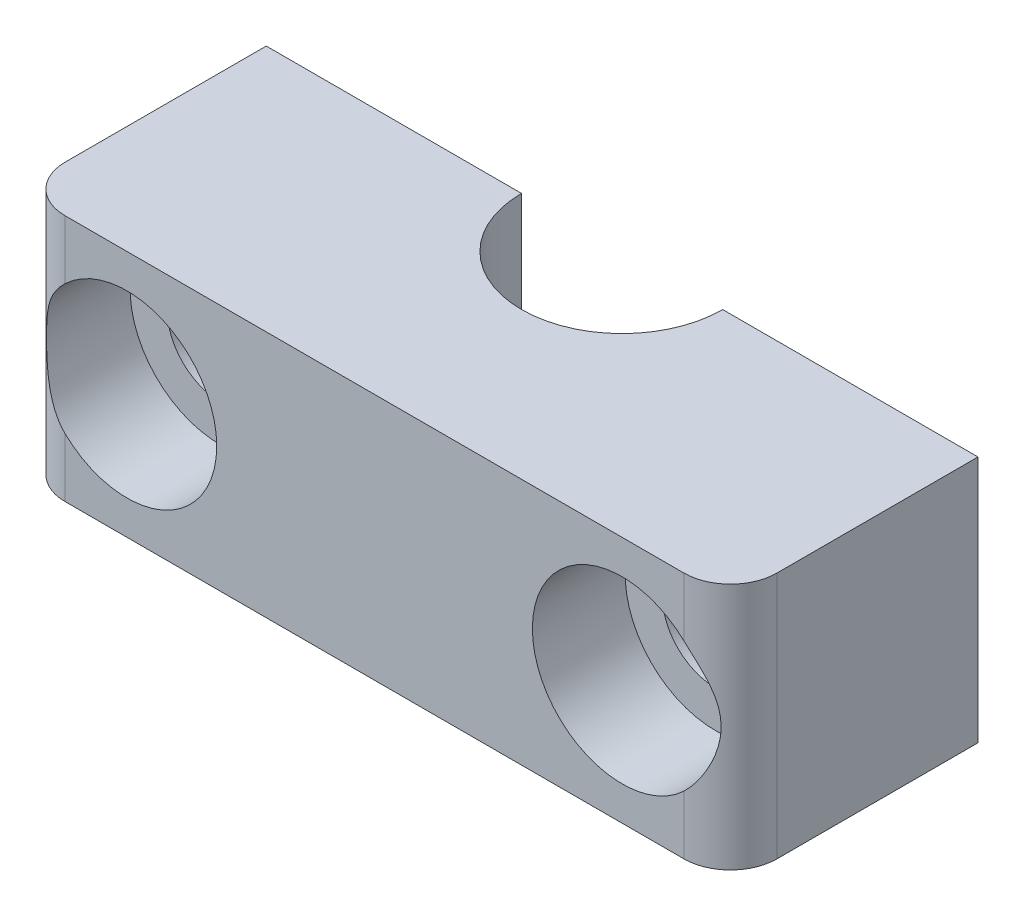
from build123d import *

# Parameters (mm, degrees)
SKETCH1_W                      = 23
SKETCH1_H                      = 8
BOSS_EXTRUDE1_DEPTH            = 8
SKETCH2_R                      = 5
CUT_EXTRUDE1_DEPTH             = 15.568802284
CBORE_FOR_M3_SHCS1_D           = 3.4
CBORE_FOR_M3_SHCS1_CBORE_D     = 5.8
CBORE_FOR_M3_SHCS1_CBORE_DEPTH = 3
SKETCH8_R                      = 3.25
CUT_EXTRUDE2_DEPTH             = 15.568802284
FILLET1_R                      = 1.5


with BuildPart() as part:
    # Sketch1 → Boss-Extrude1 (new body)
    with BuildSketch(Plane.XY):
        Rectangle(SKETCH1_W, SKETCH1_H)
    extrude(amount=BOSS_EXTRUDE1_DEPTH)

    # Sketch2 → Cut-Extrude1 (cut, through all)
    with BuildSketch(Plane(origin=(0, 0, 0), x_dir=(1, 0, 0), z_dir=(0, 1, 0))):
        Circle(SKETCH2_R)
    extrude(amount=-CUT_EXTRUDE1_DEPTH, mode=Mode.SUBTRACT)

    # CBORE for M3 SHCS1 (through all)
    with Locations(Plane.XY.offset(8)):
        with Locations((-8, 0), (8, 0)):
            CounterBoreHole(CBORE_FOR_M3_SHCS1_D / 2, CBORE_FOR_M3_SHCS1_CBORE_D / 2, CBORE_FOR_M3_SHCS1_CBORE_DEPTH)

    # Sketch8 → Cut-Extrude2 (cut, through all)
    with BuildSketch(Plane(origin=(0, 0, 0), x_dir=(1, 0, 0), z_dir=(0, 1, 0))):
        Circle(SKETCH8_R)
    extrude(amount=CUT_EXTRUDE2_DEPTH, mode=Mode.SUBTRACT)

    # Fillet1
    # the kernel refuses this fillet: 1.5 mm, written as the material it takes off along each edge
    with BuildSketch(Plane(origin=(-11.5, -7.75, 8), x_dir=(1, 0, 0), z_dir=(0, 1, 0))) as fillet1_piece_1:
        with BuildLine():
            CenterArc((FILLET1_R, FILLET1_R), FILLET1_R, 180, 90)
            Line((0, FILLET1_R), (0, 0))
            Line((0, 0), (FILLET1_R, 0))
        make_face()
    extrude(amount=15.5, mode=Mode.SUBTRACT)
    with BuildSketch(Plane(origin=(11.5, 7.75, 8), x_dir=(0, 0, -1), z_dir=(0, -1, 0))) as fillet1_piece_2:
        with BuildLine():
            CenterArc((FILLET1_R, -FILLET1_R), FILLET1_R, 90, 90)
            Line((0, -FILLET1_R), (0, 0))
            Line((0, 0), (FILLET1_R, 0))
        make_face()
    extrude(amount=15.5, mode=Mode.SUBTRACT)


solid = part.part
